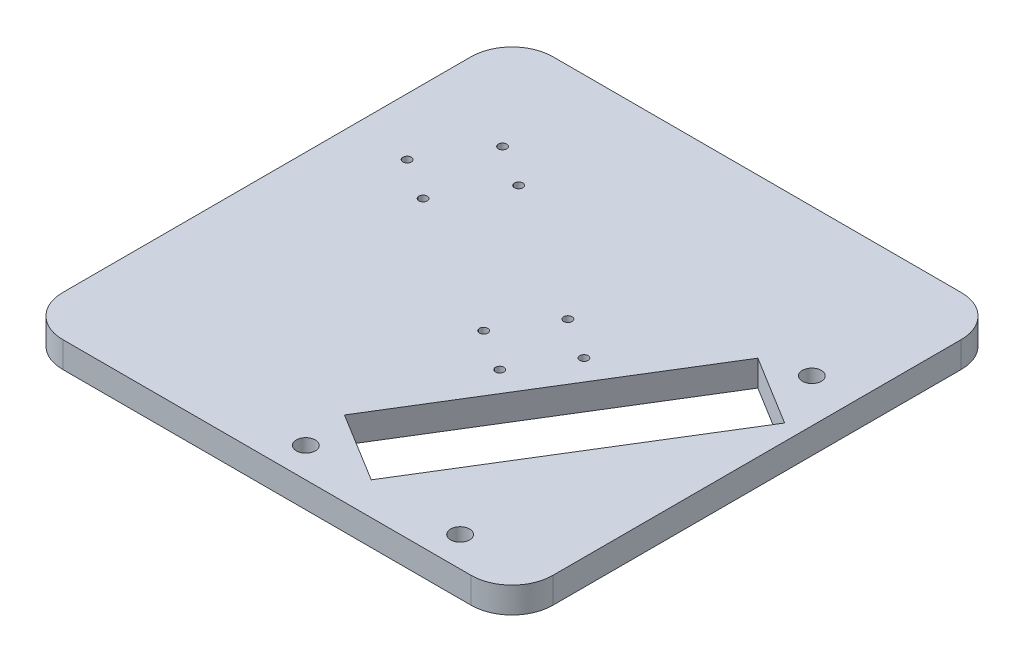
from build123d import *

# Parameters (mm, degrees)
BOSS_EXTRUDE1_DEPTH = 6.35
SKETCH2_R           = 2.325
CUT_EXTRUDE1_DEPTH  = 170.824387236
SKETCH5_R           = 1.025
CUT_EXTRUDE2_DEPTH  = 170.824387236


with BuildPart() as part:
    # Sketch1 → Boss-Extrude1 (new body)
    with BuildSketch(Plane(origin=(0, 0, 0), x_dir=(1, 0, 0), z_dir=(0, 1, 0))):
        with BuildLine():
            Line((10, 0), (110, 0))
            ThreePointArc((110, 0), (117.071067812, 2.928932188), (120, 10))
            Line((120, 10), (120, 110))
            ThreePointArc((120, 110), (117.071067812, 117.071067812), (110, 120))
            Line((110, 120), (10, 120))
            ThreePointArc((10, 120), (2.928932188, 117.071067812), (0, 110))
            Line((0, 110), (0, 10))
            ThreePointArc((0, 10), (2.928932188, 2.928932188), (10, 0))
        make_face()
    extrude(amount=BOSS_EXTRUDE1_DEPTH)

    # Sketch2 → Cut-Extrude1 (cut, through all)
    with BuildSketch(Plane(origin=(0, 6.35, 0), x_dir=(1, 0, 0), z_dir=(0, 1, 0))):
        with Locations((62.192235265, 7.325)):
            Circle(SKETCH2_R)
        with Locations((99.974668934, 7.325)):
            Circle(SKETCH2_R)
        with Locations((109.393095317, 84.031927265)):
            Circle(SKETCH2_R)
        Polygon((60.471691743, 18.506055104), (77.505195351, 8.02465468), (116.066267511, 70.690914453), (99.032763904, 81.172314877), align=None)
    extrude(amount=-CUT_EXTRUDE1_DEPTH, mode=Mode.SUBTRACT)

    # Sketch5 → Cut-Extrude2 (cut, through all)
    with BuildSketch(Plane(origin=(0, 6.35, 0), x_dir=(1, 0, 0), z_dir=(0, 1, 0))):
        with Locations((69.859976402, 47.120111286)):
            Circle(SKETCH5_R)
        with Locations((59.639874237, 53.408951541)):
            Circle(SKETCH5_R)
        with Locations((77.72102672, 59.895238992)):
            Circle(SKETCH5_R)
        with Locations((67.500924556, 66.184079246)):
            Circle(SKETCH5_R)
        with Locations((13.977019656, 80.332987484)):
            Circle(SKETCH5_R)
        with Locations((24.197121821, 74.04414723)):
            Circle(SKETCH5_R)
        with Locations((33.106312181, 88.522625296)):
            Circle(SKETCH5_R)
        with Locations((22.886210017, 94.811465551)):
            Circle(SKETCH5_R)
    extrude(amount=-CUT_EXTRUDE2_DEPTH, mode=Mode.SUBTRACT)


solid = part.part
